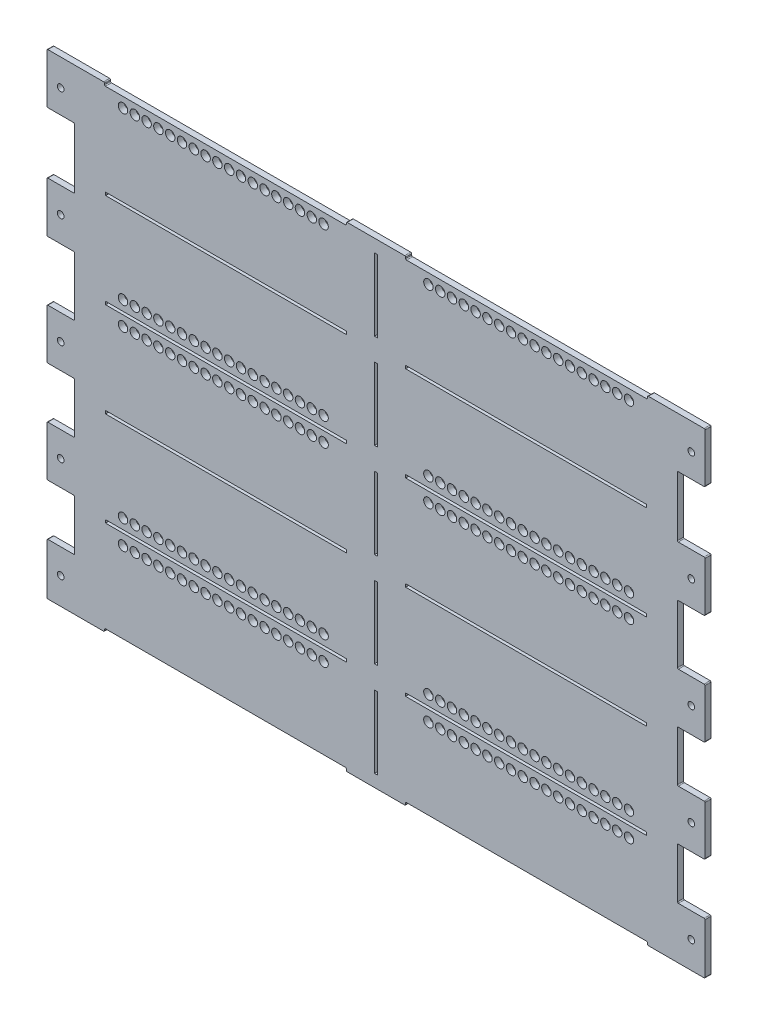
from build123d import *

# Parameters (mm, degrees)
SKETCH2_W            = 629.90984
SKETCH2_H            = 495.5921
SKETCH2_W_2          = 254
SKETCH2_H_2          = 3.175
SKETCH2_W_3          = 3.175
SKETCH2_H_3          = 76.2
BOSS_EXTRUDE1_DEPTH  = 6.35
SKETCH4_W            = 62.54242
SKETCH4_H            = 3.175
SKETCH4_W_2          = 28.585012188
BOSS_EXTRUDE2_DEPTH  = 6.35
BOSS_EXTRUDE3_DEPTH  = 6.35
M6_CLEARANCE_HOLE1_D = 7
SKETCH13_W           = 29.083193723
SKETCH13_H           = 64.286640318
SKETCH13_H_2         = 62.707681577
SKETCH13_H_3         = 53.85675143
SKETCH13_H_4         = 54.031202084
CUT_EXTRUDE1_DEPTH   = 828.140731679
SKETCH15_R           = 5
CUT_EXTRUDE5_DEPTH   = 828.140731679
FILLET1_R            = 1


with BuildPart() as part:
    # Sketch2 → Boss-Extrude1 (new body)
    with BuildSketch(Plane.XY):
        with Locations((313.68492, 246.52605)):
            Rectangle(SKETCH2_W, SKETCH2_H)
        with Locations((155.41371, 96.89592)):
            Rectangle(SKETCH2_W_2, SKETCH2_H_2, mode=Mode.SUBTRACT)
        with Locations((155.41371, 196.64934)):
            Rectangle(SKETCH2_W_2, SKETCH2_H_2, mode=Mode.SUBTRACT)
        with Locations((155.41371, 296.40276)):
            Rectangle(SKETCH2_W_2, SKETCH2_H_2, mode=Mode.SUBTRACT)
        with Locations((155.41371, 396.15618)):
            Rectangle(SKETCH2_W_2, SKETCH2_H_2, mode=Mode.SUBTRACT)
        with Locations((471.95613, 96.89592)):
            Rectangle(SKETCH2_W_2, SKETCH2_H_2, mode=Mode.SUBTRACT)
        with Locations((471.95613, 196.64934)):
            Rectangle(SKETCH2_W_2, SKETCH2_H_2, mode=Mode.SUBTRACT)
        with Locations((471.95613, 396.15618)):
            Rectangle(SKETCH2_W_2, SKETCH2_H_2, mode=Mode.SUBTRACT)
        with Locations((471.95613, 296.40276)):
            Rectangle(SKETCH2_W_2, SKETCH2_H_2, mode=Mode.SUBTRACT)
        with Locations((313.68492, 46.625498166)):
            Rectangle(SKETCH2_W_3, SKETCH2_H_3, mode=Mode.SUBTRACT)
        with Locations((313.68492, 146.77263)):
            Rectangle(SKETCH2_W_3, SKETCH2_H_3, mode=Mode.SUBTRACT)
        with Locations((313.68492, 246.52605)):
            Rectangle(SKETCH2_W_3, SKETCH2_H_3, mode=Mode.SUBTRACT)
        with Locations((313.68492, 346.27947)):
            Rectangle(SKETCH2_W_3, SKETCH2_H_3, mode=Mode.SUBTRACT)
        with Locations((313.68492, 446.03289)):
            Rectangle(SKETCH2_W_3, SKETCH2_H_3, mode=Mode.SUBTRACT)
    extrude(amount=BOSS_EXTRUDE1_DEPTH)

    # Sketch4 → Boss-Extrude2 (add, through all)
    with BuildSketch(Plane.XY.offset(6.35)):
        with Locations((313.68492, 495.9096)):
            Rectangle(SKETCH4_W, SKETCH4_H)
        with Locations((13.022506094, -2.8575)):
            Rectangle(SKETCH4_W_2, SKETCH4_H)
        with Locations((614.347333906, -2.8575)):
            Rectangle(SKETCH4_W_2, SKETCH4_H)
        with Locations((313.68492, -2.8575)):
            Rectangle(SKETCH4_W, SKETCH4_H)
        with Locations((614.347333906, 495.9096)):
            Rectangle(SKETCH4_W_2, SKETCH4_H)
        with Locations((13.022506094, 495.9096)):
            Rectangle(SKETCH4_W_2, SKETCH4_H)
    extrude(amount=-BOSS_EXTRUDE2_DEPTH)

    # Sketch5 → Boss-Extrude3 (add, through all)
    with BuildSketch(Plane.XY.offset(6.35)):
        Polygon((-33.401, 494.3221), (-33.401, 497.4971), (-1.27, 497.4971), (-1.27, 494.3221), (-1.27, -4.445), (-33.401, -4.445), align=None)
        Polygon((628.63984, 494.3221), (628.63984, -4.445), (660.77084, -4.445), (660.77084, 494.3221), (660.77084, 497.4971), (628.63984, 497.4971), align=None)
    extrude(amount=-BOSS_EXTRUDE3_DEPTH)

    # M6 Clearance Hole1 (through all)
    with Locations(Plane.XY.offset(6.35)):
        with Locations((-18.923, 469.322099962), (-18.923, 353.404472554), (-18.923, 237.486845146), (-18.923, 130.608422592), (-18.923, 23.730000038), (646.29284, 23.730000038), (646.29284, 130.608422592), (646.29284, 237.486845146), (646.29284, 353.404472554), (646.29284, 469.322099962)):
            Hole(M6_CLEARANCE_HOLE1_D / 2)

    # Sketch13 → Cut-Extrude1 (cut, through all)
    with BuildSketch(Plane.XY.offset(6.35)):
        with Locations((-18.859403139, 412.253779841)):
            Rectangle(SKETCH13_W, SKETCH13_H)
        with Locations((-18.859403139, 295.344644638)):
            Rectangle(SKETCH13_W, SKETCH13_H_2)
        with Locations((-18.859403139, 184.054510729)):
            Rectangle(SKETCH13_W, SKETCH13_H_3)
        with Locations((-18.859403139, 77.075109128)):
            Rectangle(SKETCH13_W, SKETCH13_H_4)
        with Locations((646.229243139, 77.075109128)):
            Rectangle(SKETCH13_W, SKETCH13_H_4)
        with Locations((646.229243139, 184.054510729)):
            Rectangle(SKETCH13_W, SKETCH13_H_3)
        with Locations((646.229243139, 295.344644638)):
            Rectangle(SKETCH13_W, SKETCH13_H_2)
        with Locations((646.229243139, 412.253779841)):
            Rectangle(SKETCH13_W, SKETCH13_H)
    extrude(amount=-CUT_EXTRUDE1_DEPTH, mode=Mode.SUBTRACT)

    # Sketch15 → Cut-Extrude5 (cut, through all)
    with BuildSketch(Plane.XY):
        with Locations((580.56526, 483.6541)):
            Circle(SKETCH15_R)
        with Locations((568.11926, 483.6541)):
            Circle(SKETCH15_R)
        with Locations((555.67326, 483.6541)):
            Circle(SKETCH15_R)
        with Locations((543.22726, 483.6541)):
            Circle(SKETCH15_R)
        with Locations((530.78126, 483.6541)):
            Circle(SKETCH15_R)
        with Locations((518.33526, 483.6541)):
            Circle(SKETCH15_R)
        with Locations((505.88926, 483.6541)):
            Circle(SKETCH15_R)
        with Locations((493.44326, 483.6541)):
            Circle(SKETCH15_R)
        with Locations((480.99726, 483.6541)):
            Circle(SKETCH15_R)
        with Locations((468.55126, 483.6541)):
            Circle(SKETCH15_R)
        with Locations((456.10526, 483.6541)):
            Circle(SKETCH15_R)
        with Locations((443.65926, 483.6541)):
            Circle(SKETCH15_R)
        with Locations((431.21326, 483.6541)):
            Circle(SKETCH15_R)
        with Locations((418.76726, 483.6541)):
            Circle(SKETCH15_R)
        with Locations((406.32126, 483.6541)):
            Circle(SKETCH15_R)
        with Locations((393.87526, 483.6541)):
            Circle(SKETCH15_R)
        with Locations((381.42926, 483.6541)):
            Circle(SKETCH15_R)
        with Locations((368.98326, 483.6541)):
            Circle(SKETCH15_R)
        with Locations(Location((258.38658, 483.6541, 0), (0, 0, 180))):
            Circle(SKETCH15_R)
        with Locations(Location((245.94058, 483.6541, 0), (0, 0, 180))):
            Circle(SKETCH15_R)
        with Locations(Location((233.49458, 483.6541, 0), (0, 0, 180))):
            Circle(SKETCH15_R)
        with Locations(Location((221.04858, 483.6541, 0), (0, 0, 180))):
            Circle(SKETCH15_R)
        with Locations(Location((208.60258, 483.6541, 0), (0, 0, 180))):
            Circle(SKETCH15_R)
        with Locations(Location((196.15658, 483.6541, 0), (0, 0, 180))):
            Circle(SKETCH15_R)
        with Locations(Location((183.71058, 483.6541, 0), (0, 0, 180))):
            Circle(SKETCH15_R)
        with Locations(Location((171.26458, 483.6541, 0), (0, 0, 180))):
            Circle(SKETCH15_R)
        with Locations(Location((158.81858, 483.6541, 0), (0, 0, 180))):
            Circle(SKETCH15_R)
        with Locations(Location((146.37258, 483.6541, 0), (0, 0, 180))):
            Circle(SKETCH15_R)
        with Locations(Location((133.92658, 483.6541, 0), (0, 0, 180))):
            Circle(SKETCH15_R)
        with Locations(Location((121.48058, 483.6541, 0), (0, 0, 180))):
            Circle(SKETCH15_R)
        with Locations(Location((109.03458, 483.6541, 0), (0, 0, 180))):
            Circle(SKETCH15_R)
        with Locations(Location((96.58858, 483.6541, 0), (0, 0, 180))):
            Circle(SKETCH15_R)
        with Locations(Location((84.14258, 483.6541, 0), (0, 0, 180))):
            Circle(SKETCH15_R)
        with Locations(Location((71.69658, 483.6541, 0), (0, 0, 180))):
            Circle(SKETCH15_R)
        with Locations(Location((59.25058, 483.6541, 0), (0, 0, 180))):
            Circle(SKETCH15_R)
        with Locations(Location((46.80458, 483.6541, 0), (0, 0, 180))):
            Circle(SKETCH15_R)
        with Locations((580.56526, 308.65826)):
            Circle(SKETCH15_R)
        with Locations((568.11926, 308.65826)):
            Circle(SKETCH15_R)
        with Locations((555.67326, 308.65826)):
            Circle(SKETCH15_R)
        with Locations((543.22726, 308.65826)):
            Circle(SKETCH15_R)
        with Locations((530.78126, 308.65826)):
            Circle(SKETCH15_R)
        with Locations((518.33526, 308.65826)):
            Circle(SKETCH15_R)
        with Locations((505.88926, 308.65826)):
            Circle(SKETCH15_R)
        with Locations((493.44326, 308.65826)):
            Circle(SKETCH15_R)
        with Locations((480.99726, 308.65826)):
            Circle(SKETCH15_R)
        with Locations((468.55126, 308.65826)):
            Circle(SKETCH15_R)
        with Locations((456.10526, 308.65826)):
            Circle(SKETCH15_R)
        with Locations((443.65926, 308.65826)):
            Circle(SKETCH15_R)
        with Locations((431.21326, 308.65826)):
            Circle(SKETCH15_R)
        with Locations((418.76726, 308.65826)):
            Circle(SKETCH15_R)
        with Locations((406.32126, 308.65826)):
            Circle(SKETCH15_R)
        with Locations((393.87526, 308.65826)):
            Circle(SKETCH15_R)
        with Locations((381.42926, 308.65826)):
            Circle(SKETCH15_R)
        with Locations((368.98326, 308.65826)):
            Circle(SKETCH15_R)
        with Locations(Location((258.38658, 308.65826, 0), (0, 0, 180))):
            Circle(SKETCH15_R)
        with Locations(Location((245.94058, 308.65826, 0), (0, 0, 180))):
            Circle(SKETCH15_R)
        with Locations(Location((233.49458, 308.65826, 0), (0, 0, 180))):
            Circle(SKETCH15_R)
        with Locations(Location((221.04858, 308.65826, 0), (0, 0, 180))):
            Circle(SKETCH15_R)
        with Locations(Location((208.60258, 308.65826, 0), (0, 0, 180))):
            Circle(SKETCH15_R)
        with Locations(Location((196.15658, 308.65826, 0), (0, 0, 180))):
            Circle(SKETCH15_R)
        with Locations(Location((183.71058, 308.65826, 0), (0, 0, 180))):
            Circle(SKETCH15_R)
        with Locations(Location((171.26458, 308.65826, 0), (0, 0, 180))):
            Circle(SKETCH15_R)
        with Locations(Location((158.81858, 308.65826, 0), (0, 0, 180))):
            Circle(SKETCH15_R)
        with Locations(Location((146.37258, 308.65826, 0), (0, 0, 180))):
            Circle(SKETCH15_R)
        with Locations(Location((133.92658, 308.65826, 0), (0, 0, 180))):
            Circle(SKETCH15_R)
        with Locations(Location((121.48058, 308.65826, 0), (0, 0, 180))):
            Circle(SKETCH15_R)
        with Locations(Location((109.03458, 308.65826, 0), (0, 0, 180))):
            Circle(SKETCH15_R)
        with Locations(Location((96.58858, 308.65826, 0), (0, 0, 180))):
            Circle(SKETCH15_R)
        with Locations(Location((84.14258, 308.65826, 0), (0, 0, 180))):
            Circle(SKETCH15_R)
        with Locations(Location((71.69658, 308.65826, 0), (0, 0, 180))):
            Circle(SKETCH15_R)
        with Locations(Location((59.25058, 308.65826, 0), (0, 0, 180))):
            Circle(SKETCH15_R)
        with Locations(Location((46.80458, 308.65826, 0), (0, 0, 180))):
            Circle(SKETCH15_R)
        with Locations((580.56526, 284.14726)):
            Circle(SKETCH15_R)
        with Locations((568.11926, 284.14726)):
            Circle(SKETCH15_R)
        with Locations((555.67326, 284.14726)):
            Circle(SKETCH15_R)
        with Locations((543.22726, 284.14726)):
            Circle(SKETCH15_R)
        with Locations((530.78126, 284.14726)):
            Circle(SKETCH15_R)
        with Locations((518.33526, 284.14726)):
            Circle(SKETCH15_R)
        with Locations((505.88926, 284.14726)):
            Circle(SKETCH15_R)
        with Locations((493.44326, 284.14726)):
            Circle(SKETCH15_R)
        with Locations((480.99726, 284.14726)):
            Circle(SKETCH15_R)
        with Locations((468.55126, 284.14726)):
            Circle(SKETCH15_R)
        with Locations((456.10526, 284.14726)):
            Circle(SKETCH15_R)
        with Locations((443.65926, 284.14726)):
            Circle(SKETCH15_R)
        with Locations((431.21326, 284.14726)):
            Circle(SKETCH15_R)
        with Locations((418.76726, 284.14726)):
            Circle(SKETCH15_R)
        with Locations((406.32126, 284.14726)):
            Circle(SKETCH15_R)
        with Locations((393.87526, 284.14726)):
            Circle(SKETCH15_R)
        with Locations((381.42926, 284.14726)):
            Circle(SKETCH15_R)
        with Locations((368.98326, 284.14726)):
            Circle(SKETCH15_R)
        with Locations(Location((258.38658, 284.14726, 0), (0, 0, 180))):
            Circle(SKETCH15_R)
        with Locations(Location((245.94058, 284.14726, 0), (0, 0, 180))):
            Circle(SKETCH15_R)
        with Locations(Location((233.49458, 284.14726, 0), (0, 0, 180))):
            Circle(SKETCH15_R)
        with Locations(Location((221.04858, 284.14726, 0), (0, 0, 180))):
            Circle(SKETCH15_R)
        with Locations(Location((208.60258, 284.14726, 0), (0, 0, 180))):
            Circle(SKETCH15_R)
        with Locations(Location((196.15658, 284.14726, 0), (0, 0, 180))):
            Circle(SKETCH15_R)
        with Locations(Location((183.71058, 284.14726, 0), (0, 0, 180))):
            Circle(SKETCH15_R)
        with Locations(Location((171.26458, 284.14726, 0), (0, 0, 180))):
            Circle(SKETCH15_R)
        with Locations(Location((158.81858, 284.14726, 0), (0, 0, 180))):
            Circle(SKETCH15_R)
        with Locations(Location((146.37258, 284.14726, 0), (0, 0, 180))):
            Circle(SKETCH15_R)
        with Locations(Location((133.92658, 284.14726, 0), (0, 0, 180))):
            Circle(SKETCH15_R)
        with Locations(Location((121.48058, 284.14726, 0), (0, 0, 180))):
            Circle(SKETCH15_R)
        with Locations(Location((109.03458, 284.14726, 0), (0, 0, 180))):
            Circle(SKETCH15_R)
        with Locations(Location((96.58858, 284.14726, 0), (0, 0, 180))):
            Circle(SKETCH15_R)
        with Locations(Location((84.14258, 284.14726, 0), (0, 0, 180))):
            Circle(SKETCH15_R)
        with Locations(Location((71.69658, 284.14726, 0), (0, 0, 180))):
            Circle(SKETCH15_R)
        with Locations(Location((59.25058, 284.14726, 0), (0, 0, 180))):
            Circle(SKETCH15_R)
        with Locations(Location((46.80458, 284.14726, 0), (0, 0, 180))):
            Circle(SKETCH15_R)
        with Locations((580.56526, 109.15142)):
            Circle(SKETCH15_R)
        with Locations((568.11926, 109.15142)):
            Circle(SKETCH15_R)
        with Locations((555.67326, 109.15142)):
            Circle(SKETCH15_R)
        with Locations((543.22726, 109.15142)):
            Circle(SKETCH15_R)
        with Locations((530.78126, 109.15142)):
            Circle(SKETCH15_R)
        with Locations((518.33526, 109.15142)):
            Circle(SKETCH15_R)
        with Locations((505.88926, 109.15142)):
            Circle(SKETCH15_R)
        with Locations((493.44326, 109.15142)):
            Circle(SKETCH15_R)
        with Locations((480.99726, 109.15142)):
            Circle(SKETCH15_R)
        with Locations((468.55126, 109.15142)):
            Circle(SKETCH15_R)
        with Locations((456.10526, 109.15142)):
            Circle(SKETCH15_R)
        with Locations((443.65926, 109.15142)):
            Circle(SKETCH15_R)
        with Locations((431.21326, 109.15142)):
            Circle(SKETCH15_R)
        with Locations((418.76726, 109.15142)):
            Circle(SKETCH15_R)
        with Locations((406.32126, 109.15142)):
            Circle(SKETCH15_R)
        with Locations((393.87526, 109.15142)):
            Circle(SKETCH15_R)
        with Locations((381.42926, 109.15142)):
            Circle(SKETCH15_R)
        with Locations((368.98326, 109.15142)):
            Circle(SKETCH15_R)
        with Locations(Location((258.38658, 109.15142, 0), (0, 0, 180))):
            Circle(SKETCH15_R)
        with Locations(Location((245.94058, 109.15142, 0), (0, 0, 180))):
            Circle(SKETCH15_R)
        with Locations(Location((233.49458, 109.15142, 0), (0, 0, 180))):
            Circle(SKETCH15_R)
        with Locations(Location((221.04858, 109.15142, 0), (0, 0, 180))):
            Circle(SKETCH15_R)
        with Locations(Location((208.60258, 109.15142, 0), (0, 0, 180))):
            Circle(SKETCH15_R)
        with Locations(Location((196.15658, 109.15142, 0), (0, 0, 180))):
            Circle(SKETCH15_R)
        with Locations(Location((183.71058, 109.15142, 0), (0, 0, 180))):
            Circle(SKETCH15_R)
        with Locations(Location((171.26458, 109.15142, 0), (0, 0, 180))):
            Circle(SKETCH15_R)
        with Locations(Location((158.81858, 109.15142, 0), (0, 0, 180))):
            Circle(SKETCH15_R)
        with Locations(Location((146.37258, 109.15142, 0), (0, 0, 180))):
            Circle(SKETCH15_R)
        with Locations(Location((133.92658, 109.15142, 0), (0, 0, 180))):
            Circle(SKETCH15_R)
        with Locations(Location((121.48058, 109.15142, 0), (0, 0, 180))):
            Circle(SKETCH15_R)
        with Locations(Location((109.03458, 109.15142, 0), (0, 0, 180))):
            Circle(SKETCH15_R)
        with Locations(Location((96.58858, 109.15142, 0), (0, 0, 180))):
            Circle(SKETCH15_R)
        with Locations(Location((84.14258, 109.15142, 0), (0, 0, 180))):
            Circle(SKETCH15_R)
        with Locations(Location((71.69658, 109.15142, 0), (0, 0, 180))):
            Circle(SKETCH15_R)
        with Locations(Location((59.25058, 109.15142, 0), (0, 0, 180))):
            Circle(SKETCH15_R)
        with Locations(Location((46.80458, 109.15142, 0), (0, 0, 180))):
            Circle(SKETCH15_R)
        with Locations((580.56526, 83.852996332)):
            Circle(SKETCH15_R)
        with Locations((568.11926, 83.852996332)):
            Circle(SKETCH15_R)
        with Locations((555.67326, 83.852996332)):
            Circle(SKETCH15_R)
        with Locations((543.22726, 83.852996332)):
            Circle(SKETCH15_R)
        with Locations((530.78126, 83.852996332)):
            Circle(SKETCH15_R)
        with Locations((518.33526, 83.852996332)):
            Circle(SKETCH15_R)
        with Locations((505.88926, 83.852996332)):
            Circle(SKETCH15_R)
        with Locations((493.44326, 83.852996332)):
            Circle(SKETCH15_R)
        with Locations((480.99726, 83.852996332)):
            Circle(SKETCH15_R)
        with Locations((468.55126, 83.852996332)):
            Circle(SKETCH15_R)
        with Locations((456.10526, 83.852996332)):
            Circle(SKETCH15_R)
        with Locations((443.65926, 83.852996332)):
            Circle(SKETCH15_R)
        with Locations((431.21326, 83.852996332)):
            Circle(SKETCH15_R)
        with Locations((418.76726, 83.852996332)):
            Circle(SKETCH15_R)
        with Locations((406.32126, 83.852996332)):
            Circle(SKETCH15_R)
        with Locations((393.87526, 83.852996332)):
            Circle(SKETCH15_R)
        with Locations((381.42926, 83.852996332)):
            Circle(SKETCH15_R)
        with Locations((368.98326, 83.852996332)):
            Circle(SKETCH15_R)
        with Locations(Location((258.38658, 83.852996332, 0), (0, 0, 180))):
            Circle(SKETCH15_R)
        with Locations(Location((245.94058, 83.852996332, 0), (0, 0, 180))):
            Circle(SKETCH15_R)
        with Locations(Location((233.49458, 83.852996332, 0), (0, 0, 180))):
            Circle(SKETCH15_R)
        with Locations(Location((221.04858, 83.852996332, 0), (0, 0, 180))):
            Circle(SKETCH15_R)
        with Locations(Location((208.60258, 83.852996332, 0), (0, 0, 180))):
            Circle(SKETCH15_R)
        with Locations(Location((196.15658, 83.852996332, 0), (0, 0, 180))):
            Circle(SKETCH15_R)
        with Locations(Location((183.71058, 83.852996332, 0), (0, 0, 180))):
            Circle(SKETCH15_R)
        with Locations(Location((171.26458, 83.852996332, 0), (0, 0, 180))):
            Circle(SKETCH15_R)
        with Locations(Location((158.81858, 83.852996332, 0), (0, 0, 180))):
            Circle(SKETCH15_R)
        with Locations(Location((146.37258, 83.852996332, 0), (0, 0, 180))):
            Circle(SKETCH15_R)
        with Locations(Location((133.92658, 83.852996332, 0), (0, 0, 180))):
            Circle(SKETCH15_R)
        with Locations(Location((121.48058, 83.852996332, 0), (0, 0, 180))):
            Circle(SKETCH15_R)
        with Locations(Location((109.03458, 83.852996332, 0), (0, 0, 180))):
            Circle(SKETCH15_R)
        with Locations(Location((96.58858, 83.852996332, 0), (0, 0, 180))):
            Circle(SKETCH15_R)
        with Locations(Location((84.14258, 83.852996332, 0), (0, 0, 180))):
            Circle(SKETCH15_R)
        with Locations(Location((71.69658, 83.852996332, 0), (0, 0, 180))):
            Circle(SKETCH15_R)
        with Locations(Location((59.25058, 83.852996332, 0), (0, 0, 180))):
            Circle(SKETCH15_R)
        with Locations(Location((46.80458, 83.852996332, 0), (0, 0, 180))):
            Circle(SKETCH15_R)
    extrude(amount=CUT_EXTRUDE5_DEPTH, mode=Mode.SUBTRACT)

    # Fillet1
    fillet1_edges = [part.edges().sort_by_distance(p)[0] for p in [
        (27.315012188, -1.27, 3.175),
        (27.315012188, -4.445, 3.175),
        (600.054827812, -1.27, 3.175),
        (600.054827812, -4.445, 3.175),
        (282.41371, 494.3221, 3.175),
        (282.41371, 497.4971, 3.175),
        (344.95613, 497.4971, 3.175),
        (344.95613, 494.3221, 3.175),
        (600.054827812, 494.3221, 3.175),
        (600.054827812, 497.4971, 3.175),
        (282.41371, -1.27, 3.175),
        (344.95613, -1.27, 3.175),
        (344.95613, -4.445, 3.175),
        (282.41371, -4.445, 3.175),
        (27.315012188, 497.4971, 3.175),
        (27.315012188, 494.3221, 3.175),
        (-33.401, 497.4971, 3.175),
        (-33.401, -4.445, 3.175),
        (660.77084, 497.4971, 3.175),
        (660.77084, -4.445, 3.175),
        (-33.401, 263.990803849, 3.175),
        (-33.401, 326.698485426, 3.175),
        (-4.317806277, 326.698485426, 3.175),
        (-4.317806277, 263.990803849, 3.175),
        (-4.317806277, 210.982886444, 3.175),
        (-4.317806277, 157.126135014, 3.175),
        (-33.401, 157.126135014, 3.175),
        (-33.401, 210.982886444, 3.175),
        (-33.401, 50.059508086, 3.175),
        (-33.401, 104.09071017, 3.175),
        (-4.317806277, 104.09071017, 3.175),
        (-4.317806277, 50.059508086, 3.175),
        (631.687646277, 104.09071017, 3.175),
        (660.77084, 104.09071017, 3.175),
        (660.77084, 50.059508086, 3.175),
        (631.687646277, 50.059508086, 3.175),
        (631.687646277, 210.982886444, 3.175),
        (660.77084, 210.982886444, 3.175),
        (660.77084, 157.126135014, 3.175),
        (631.687646277, 157.126135014, 3.175),
        (631.687646277, 326.698485426, 3.175),
        (660.77084, 326.698485426, 3.175),
        (660.77084, 263.990803849, 3.175),
        (631.687646277, 263.990803849, 3.175),
        (631.687646277, 444.3971, 3.175),
        (660.77084, 444.3971, 3.175),
        (660.77084, 380.110459682, 3.175),
        (631.687646277, 380.110459682, 3.175),
        (-33.401, 380.110459682, 3.175),
        (-33.401, 444.3971, 3.175),
        (-4.317806277, 444.3971, 3.175),
        (-4.317806277, 380.110459682, 3.175),
    ]]
    fillet(fillet1_edges, radius=FILLET1_R)


solid = part.part
